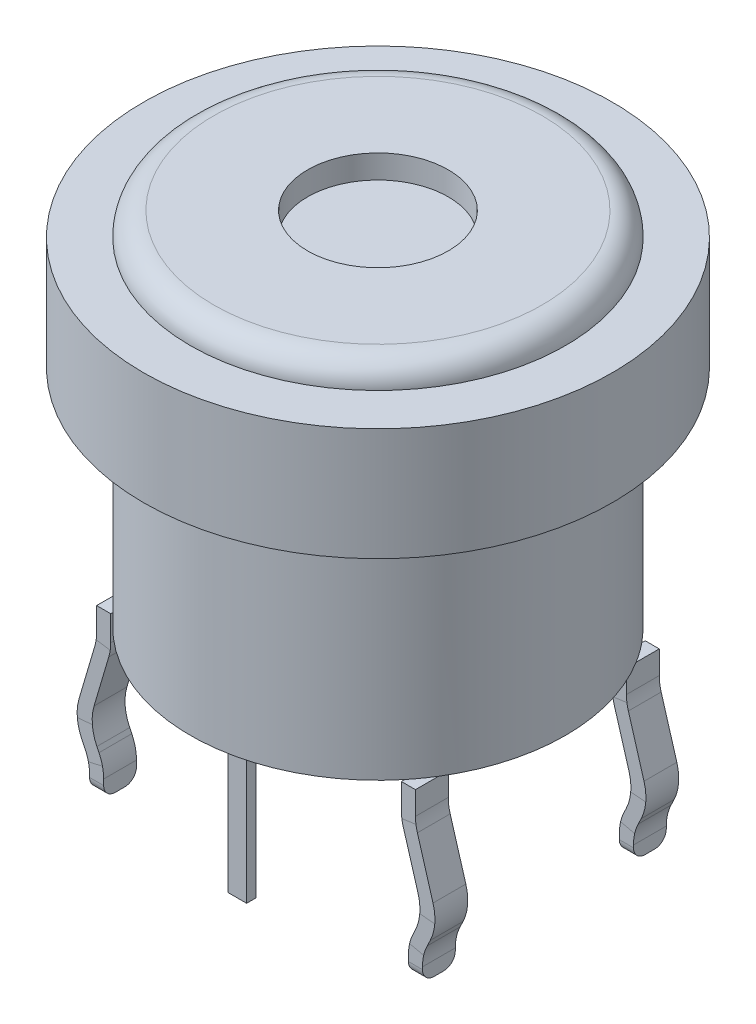
from build123d import *

# Parameters (mm, degrees)
SKETCH_1_R             = 5
EXTRUDE_1_DEPTH        = 2.4
SKETCH_2_R             = 4
EXTRUDE_2_DEPTH        = 4.8
EXTRUDE_START          = 0.5
SKETCH_3_R             = 4
EXTRUDE_3_DEPTH        = 0.5
FILLET_1_R             = 0.5
SKETCH_5_R             = 1.5
CUT_EXTRUDE_1_DEPTH    = 0.5
SKETCH_6_W             = 0.3
SKETCH_6_H             = 0.7
SKETCH_8_W             = 0.4
SKETCH_8_H             = 0.2
EXTRUDE_5_DEPTH        = 3.5
FILLET_2_R             = 1
FILLET_3_R             = 0.25
FILLET_2_OF_MIRROR_2_R = 1
FILLET_3_OF_MIRROR_2_R = 0.25


# Read off the part's stored shape, not the designer's step: Зеркальное отражение3
with BuildPart() as part:
    # Эскиз1 → Бобышка-Вытянуть1 (new body)
    with BuildSketch(Plane(origin=(0, 0, 0), x_dir=(1, 0, 0), z_dir=(0, 1, 0))):
        with Locations(Location((0, 0, 0), (0, 0, 270))):
            Circle(SKETCH_1_R)
    extrude(amount=EXTRUDE_1_DEPTH)

    # Эскиз2 → Бобышка-Вытянуть2 (add)
    with BuildSketch(Plane.XZ):
        with Locations(Location((0, 0, 0), (0, 0, 270))):
            Circle(SKETCH_2_R)
    extrude(amount=EXTRUDE_2_DEPTH)

    # Эскиз3 → Бобышка-Вытянуть3 (add)
    with BuildSketch(Plane(origin=(0, 2.4, 0), x_dir=(1, 0, 0), z_dir=(0, 1, 0)).offset(EXTRUDE_START)):
        with Locations(Location((0, 0, 0), (0, 0, 90))):
            Circle(SKETCH_3_R)
    extrude(amount=-EXTRUDE_3_DEPTH)

    # Скругление1
    fillet_1_edges = [part.edges().sort_by_distance(p)[0] for p in [
        (0, 2.9, 4),
    ]]
    fillet(fillet_1_edges, radius=FILLET_1_R - 0.0001)  # a hair under: the kernel refuses the full size

    # Эскиз5 → Вырез-Вытянуть1 (cut)
    with BuildSketch(Plane(origin=(0, 2.9, 0), x_dir=(1, 0, 0), z_dir=(0, 1, 0))):
        with Locations(Location((0, 0, 0), (0, 0, 270))):
            Circle(SKETCH_5_R)
    extrude(amount=-CUT_EXTRUDE_1_DEPTH, mode=Mode.SUBTRACT)

    # По траектории4: sweep along a curve in space
    with BuildLine() as sweep_4_path:
        Line((-3.25, -4.8, 2.25), (-3.25, -5.459878122, 2.25))
        Line((-3.25, -5.459878122, 2.25), (-3.724056905, -7.065490817, 2.25))
        Line((-3.724056905, -7.065490817, 2.25), (-3.4, -7.733693766, 2.25))
        Line((-3.4, -7.733693766, 2.25), (-3.4, -8.3, 2.25))
    # Эскиз6 → По траектории4 (sweep)
    with BuildSketch(Plane(origin=(0, -4.8, -4.8), x_dir=(-1, 0, 0), z_dir=(0, 1, 0))):
        with Locations((3.25, 7.05)):
            Rectangle(SKETCH_6_W, SKETCH_6_H)
    sweep_4 = sweep(path=sweep_4_path.line, transition=Transition.RIGHT)

    # Эскиз8 → Бобышка-Вытянуть5 (add)
    with BuildSketch(Plane(origin=(0, -4.8, 9.6), x_dir=(1, 0, 0), z_dir=(0, 1, 0))):
        with Locations((0, 12.5)):
            Rectangle(SKETCH_8_W, SKETCH_8_H)
        with Locations((0, 6.7)):
            Rectangle(SKETCH_8_W, SKETCH_8_H)
    extrude(amount=-EXTRUDE_5_DEPTH)

    # Скругление2
    fillet_2_edges = [part.edges().sort_by_distance(p)[0] for p in [
        (-3.25, -7.699240124, 2.25),
        (-3.55, -7.768147407, 2.25),
        (-3.884358836, -7.078701954, 2.25),
        (-3.563754975, -7.052279681, 2.25),
        (-3.4, -5.438197011, 2.25),
        (-3.1, -5.481559233, 2.25),
    ]]
    fillet(fillet_2_edges, radius=FILLET_2_R)

    # Скругление3
    fillet_3_edges = [part.edges().sort_by_distance(p)[0] for p in [
        (-3.4, -8.3, 1.9),
        (-3.4, -8.3, 2.6),
    ]]
    fillet(fillet_3_edges, radius=FILLET_3_R)

    # Зеркальное отражение2: По траектории4 across plane
    add(sweep_4.mirror(Plane(origin=(0, 0, 0), x_dir=(0, 0, 1), z_dir=(1, 0, 0))))

    # Скругление2 of Зеркальное отражение2
    fillet_2_of_mirror_2_edges = [part.edges().sort_by_distance(p)[0] for p in [
        (3.25, -7.699240124, 2.25),
        (3.55, -7.768147407, 2.25),
        (3.884358836, -7.078701954, 2.25),
        (3.563754975, -7.052279681, 2.25),
        (3.4, -5.438197011, 2.25),
        (3.1, -5.481559233, 2.25),
    ]]
    fillet(fillet_2_of_mirror_2_edges, radius=FILLET_2_OF_MIRROR_2_R)

    # Скругление3 of Зеркальное отражение2
    fillet_3_of_mirror_2_edges = [part.edges().sort_by_distance(p)[0] for p in [
        (3.4, -8.3, 1.9),
        (3.4, -8.3, 2.6),
    ]]
    fillet(fillet_3_of_mirror_2_edges, radius=FILLET_3_OF_MIRROR_2_R)

    # Зеркальное отражение3: part across plane


with BuildPart() as part_1:
    add(part.part)
    add(part.part.mirror(Plane.XY))


solid = part_1.part
